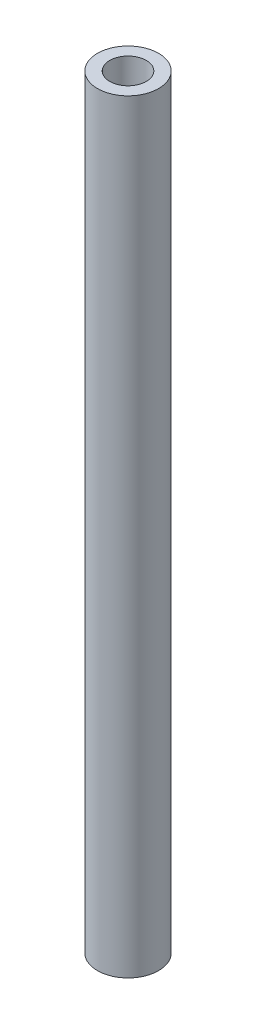
from build123d import *

# Parameters (mm, degrees)
SKETCH1_R              = 3.175
BOSS_EXTRUDE1_DEPTH    = 79.375
ATTACHHMENT_HOLE_D     = 3.7973
ATTACHHMENT_HOLE_DEPTH = 12.7
ATTACHHMENT_HOLE_TIP   = 1.140824014
F_10_24_TAPPED_D       = 3.7973
F_10_24_TAPPED_DEPTH   = 12.7
F_10_24_TAPPED_TIP     = 1.140824014


with BuildPart() as part:
    # Sketch1 → Boss-Extrude1 (new body)
    with BuildSketch(Plane(origin=(0, 0, 0), x_dir=(1, 0, 0), z_dir=(0, 1, 0))):
        Circle(SKETCH1_R)
    extrude(amount=BOSS_EXTRUDE1_DEPTH)

    # Attachhment Hole
    with Locations(Plane(origin=(0, 79.375, 0), x_dir=(1, 0, 0), z_dir=(0, 1, 0))):
        with Locations((0, 0)):
            Hole(ATTACHHMENT_HOLE_D / 2, depth=ATTACHHMENT_HOLE_DEPTH)
            with Locations((0, 0, -(ATTACHHMENT_HOLE_DEPTH + ATTACHHMENT_HOLE_TIP / 2))):  # 118° drill point
                Cone(0, ATTACHHMENT_HOLE_D / 2, ATTACHHMENT_HOLE_TIP, mode=Mode.SUBTRACT)

    # #10-24 Tapped
    with Locations(Plane(origin=(0, 0, 0), x_dir=(-1, 0, 0), z_dir=(0, -1, 0))):
        with Locations((0, 0)):
            Hole(F_10_24_TAPPED_D / 2, depth=F_10_24_TAPPED_DEPTH)
            with Locations((0, 0, -(F_10_24_TAPPED_DEPTH + F_10_24_TAPPED_TIP / 2))):  # 118° drill point
                Cone(0, F_10_24_TAPPED_D / 2, F_10_24_TAPPED_TIP, mode=Mode.SUBTRACT)


solid = part.part
